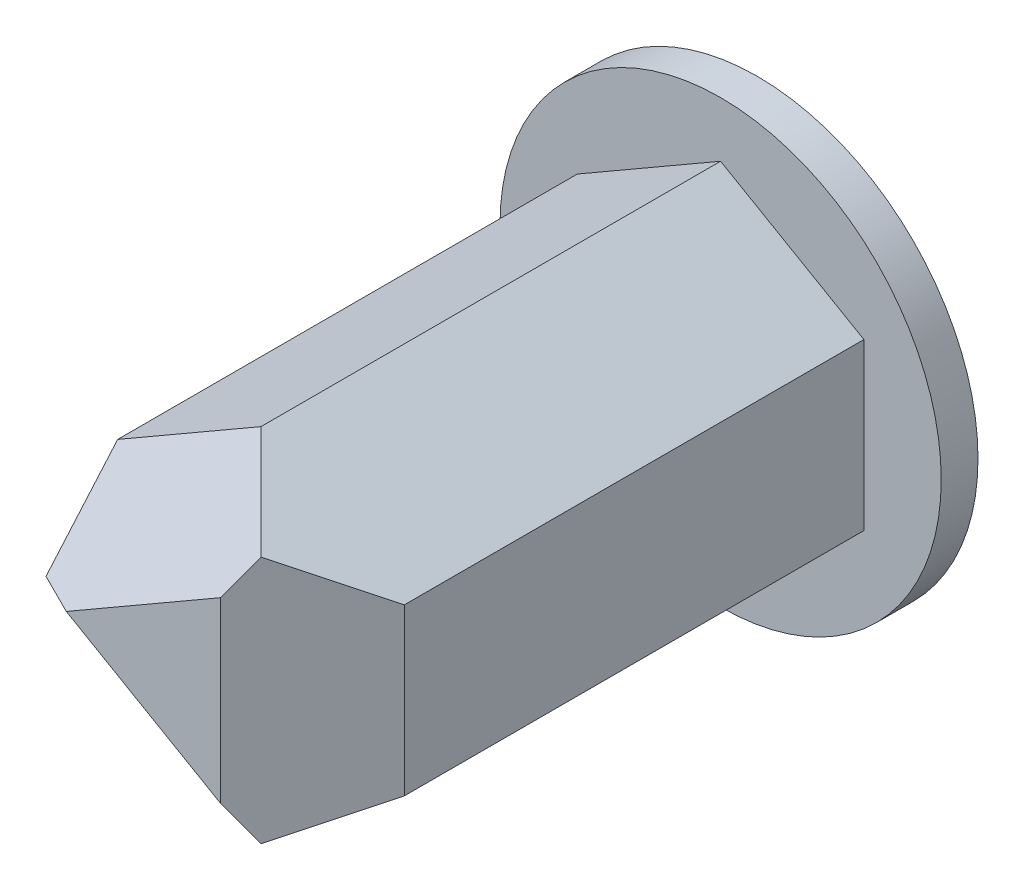
from build123d import *

# Parameters (mm, degrees)
SALIENTE_EXTRUIR1_DEPTH = 30
CROQUIS2_R              = 12
SALIENTE_EXTRUIR2_DEPTH = 2
CHAMFER1_SIZE           = 5


with BuildPart() as part:
    # Croquis1 → Saliente-Extruir1 (new body)
    with BuildSketch(Plane.XY):
        Polygon((0, 9), (-7.794228634, 4.5), (-7.794228634, -4.5), (0, -9), (7.794228634, -4.5), (7.794228634, 4.5), align=None)
    extrude(amount=SALIENTE_EXTRUIR1_DEPTH)

    # Croquis2 → Saliente-Extruir2 (add)
    with BuildSketch(Plane(origin=(0, 0, 0), x_dir=(-1, 0, 0), z_dir=(0, 0, -1))):
        Circle(CROQUIS2_R)
    extrude(amount=SALIENTE_EXTRUIR2_DEPTH)

    # Chamfer1
    # the kernel refuses this chamfer: 5 mm, written as the material it takes off along each edge
    with BuildSketch(Plane(origin=(-18.929942624, 1.92920747, 30), x_dir=(-0.013747938305293065, -0.023812127644090277, -0.9996219169112968), z_dir=(0.8660254037844416, -0.49999999999999495, 0)), Plane(origin=(7.794228634, -17.35841494, 30), x_dir=(0.027495876610586317, 0, -0.9996219169112968), z_dir=(0, 1, 0)), Plane(origin=(11.13571399, 15.42920747, 30), x_dir=(-0.013747938305293275, 0.023812127644090242, -0.9996219169112968), z_dir=(-0.8660254037844379, -0.5000000000000012, 0))) as chamfer1_piece_1:
        Polygon((CHAMFER1_SIZE * 0.999621916911, CHAMFER1_SIZE * 0.0274958766106), (-CHAMFER1_SIZE * 0.0274958766106, CHAMFER1_SIZE * 0.999621916911), (0, 0), align=None)
    extrude(amount=34.71682988, mode=Mode.SUBTRACT)


solid = part.part
